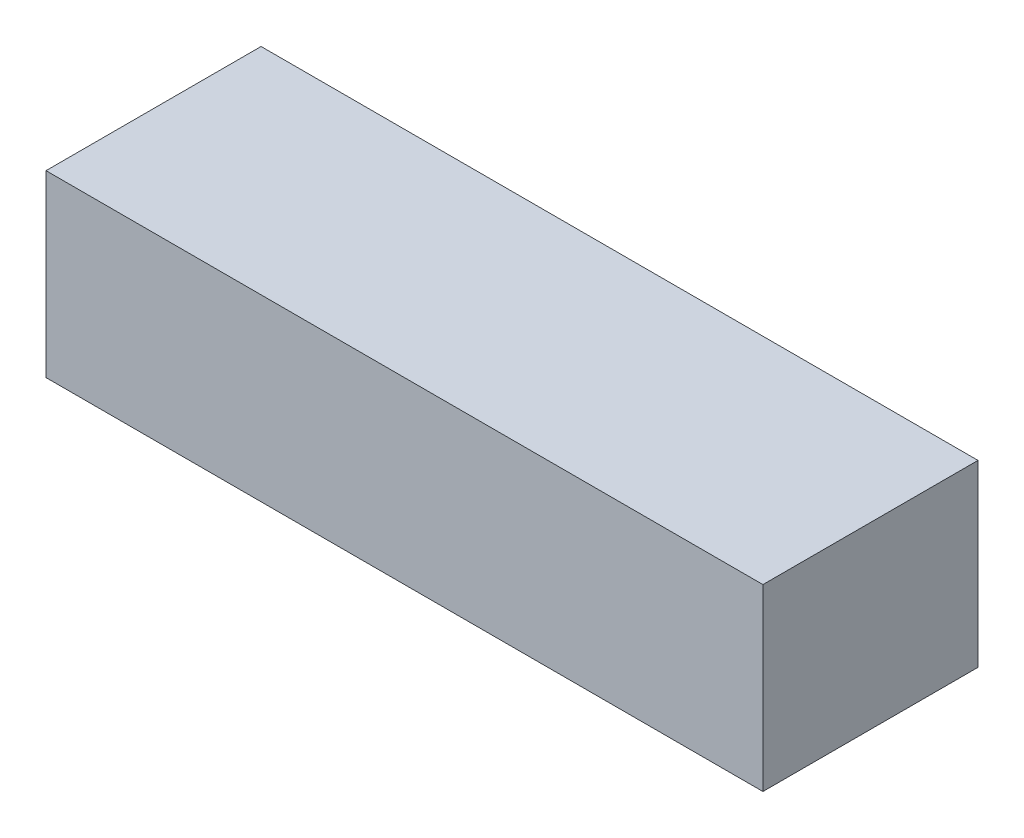
from build123d import *

# Parameters (mm, degrees)
SKETCH1_W           = 100
SKETCH1_H           = 30
BOSS_EXTRUDE1_DEPTH = 25


with BuildPart() as part:
    # Sketch1 → Boss-Extrude1 (new body)
    with BuildSketch(Plane(origin=(0, 0, 0), x_dir=(1, 0, 0), z_dir=(0, 1, 0))):
        with Locations((50, 15)):
            Rectangle(SKETCH1_W, SKETCH1_H)
    extrude(amount=BOSS_EXTRUDE1_DEPTH)


solid = part.part
